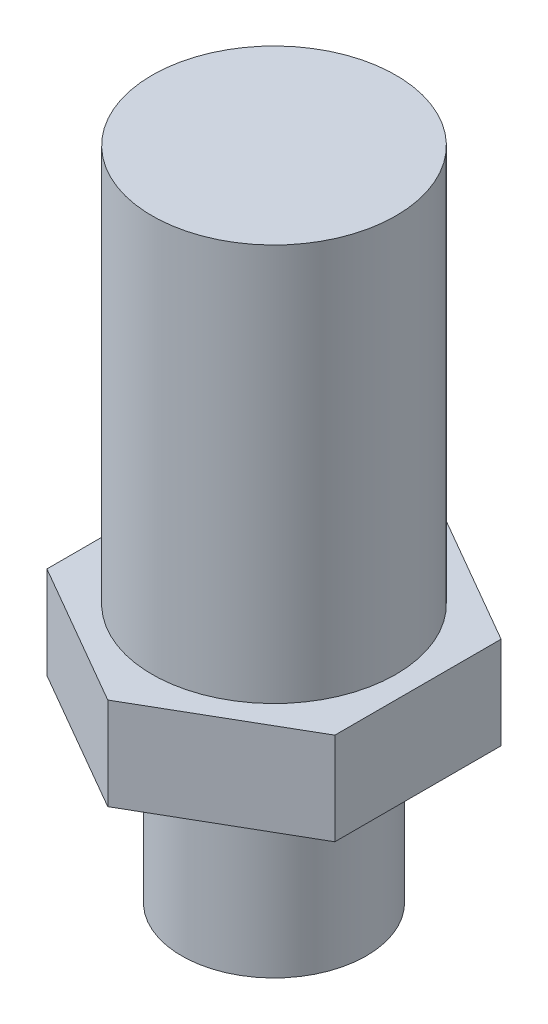
from build123d import *

# Parameters (mm, degrees)
SKETCH2_R          = 3.048
CUT_EXTRUDE1_DEPTH = 2.54


# Read off the part's stored shape, not the designer's step: Revolve1
with BuildPart() as part:
    # Revolve1 outline → Revolve1 (revolve)
    with BuildSketch(Plane(origin=(-9.292485091, 0, 0), x_dir=(1, 0, 0), z_dir=(0, 0, 1))):
        Polygon((0, -15.377840902), (0, -24.394840902), (1.27, -24.394840902), (1.27, -22.108840902), (3.048, -22.108840902), (3.048, -20.838840902), (1.6764, -20.838840902), (1.6764, -15.377840902), align=None)
    revolve(axis=Axis((-9.292485091, 0, 0), (0, 1, 0)))

    # Sketch2 → Cut-Extrude1 (cut)
    with BuildSketch(Plane(origin=(0, -20.838840902, 0), x_dir=(1, 0, 0), z_dir=(0, 1, 0))):
        with Locations((-9.292485091, 0)):
            Circle(SKETCH2_R)
        Polygon((-9.292485091, 2.286), (-7.312751018, 1.143), (-7.312751018, -1.143), (-9.292485091, -2.286), (-11.272219164, -1.143), (-11.272219164, 1.143), align=None, mode=Mode.SUBTRACT)
    extrude(amount=-CUT_EXTRUDE1_DEPTH, mode=Mode.SUBTRACT)


solid = part.part
